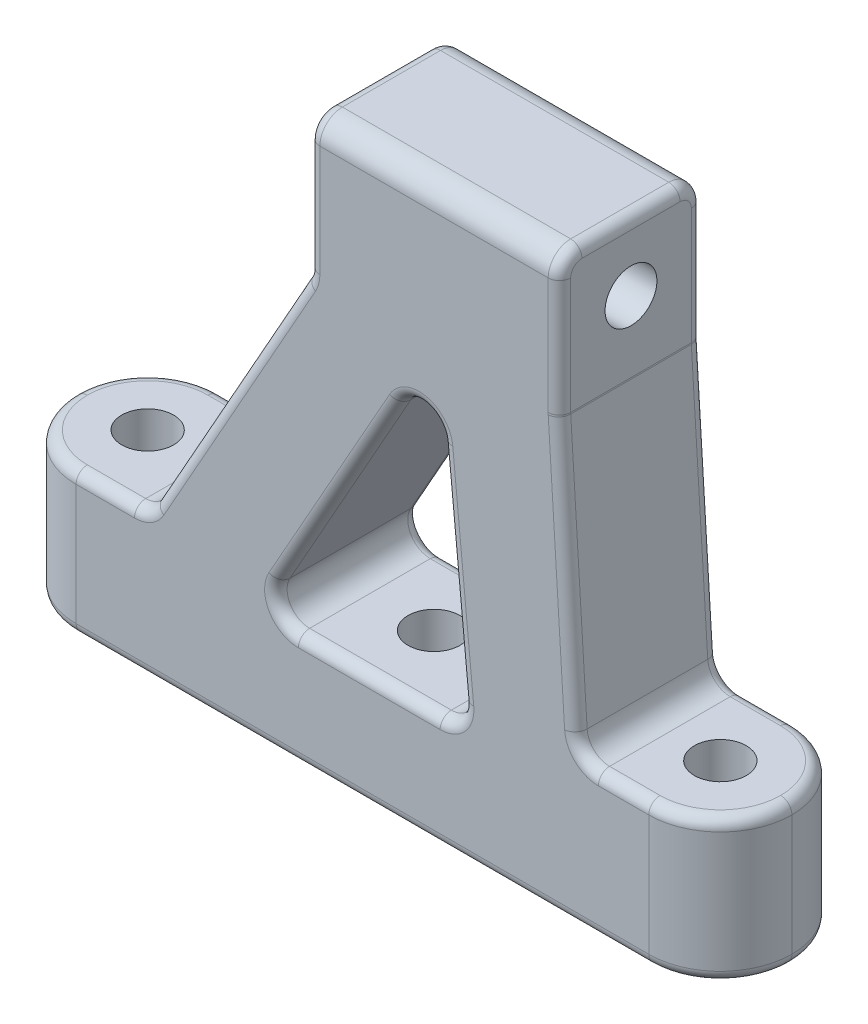
from build123d import *

# Parameters (mm, degrees)
SKETCH1_W           = 6.35
SKETCH1_H           = 12.7
SKETCH1_W_2         = 22.2504
SKETCH1_H_2         = 12.3952
BOSS_EXTRUDE1_DEPTH = 12.7
CUT_EXTRUDE1_REACH  = 52.969
SKETCH2_R           = 2.3
CUT_EXTRUDE2_REACH  = 65.601
SKETCH3_R           = 2.3
FILLET1_R           = 6.35
FILLET2_R           = 2
FILLET3_R           = 1


# Some blends are built 0.0001 mm under size
with BuildPart() as part:
    # Sketch1 → Boss-Extrude1 (new body)
    # profile 1 of 3: a face of its own
    with BuildSketch(Plane.XY):
        Polygon((-31.75, 0), (25.4, 0), (25.4, 12.7), (19.05, 12.7), (17.4752, 38.1), (-4.7752, 38.1), (-19.05, 12.7), (-31.75, 12.7), align=None)
        Polygon((9.096375634, 10), (-9.096375634, 10), (6.401231747, 37.575813845), align=None, mode=Mode.SUBTRACT)
    # profile 2 of 3: a face of its own
    with BuildSketch(Plane.XY):
        with Locations((28.575, 6.35)):
            Rectangle(SKETCH1_W, SKETCH1_H)
    # profile 3 of 3: a face of its own
    with BuildSketch(Plane.XY):
        with Locations((6.35, 44.2976)):
            Rectangle(SKETCH1_W_2, SKETCH1_H_2)
    extrude(amount=BOSS_EXTRUDE1_DEPTH)

    # Sketch2 → Cut-Extrude1 (cut, up to next)
    with BuildSketch(Plane(origin=(0, 12.7, 0), x_dir=(1, 0, 0), z_dir=(0, 1, 0)), mode=Mode.PRIVATE) as cut_extrude1_sk1:
        with Locations(Location((-25.4, -6.35, 0), (0, 0, 270))):
            Circle(SKETCH2_R)
    cut_extrude1_tool1 = extrude(cut_extrude1_sk1.sketch, amount=-CUT_EXTRUDE1_REACH, mode=Mode.PRIVATE) & part.part
    # Sketch2 → Cut-Extrude1 (cut, up to next)
    with BuildSketch(Plane(origin=(0, 12.7, 0), x_dir=(1, 0, 0), z_dir=(0, 1, 0)), mode=Mode.PRIVATE) as cut_extrude1_sk2:
        with Locations(Location((25.4, -6.35, 0), (0, 0, 270))):
            Circle(SKETCH2_R)
    cut_extrude1_tool2 = extrude(cut_extrude1_sk2.sketch, amount=-CUT_EXTRUDE1_REACH, mode=Mode.PRIVATE) & part.part
    # Sketch2 → Cut-Extrude1 (cut, up to next)
    with BuildSketch(Plane(origin=(0, 12.7, 0), x_dir=(1, 0, 0), z_dir=(0, 1, 0)), mode=Mode.PRIVATE) as cut_extrude1_sk3:
        with Locations(Location((0, -6.35, 0), (0, 0, 90))):
            Circle(SKETCH2_R)
    cut_extrude1_tool3 = extrude(cut_extrude1_sk3.sketch, amount=-CUT_EXTRUDE1_REACH, mode=Mode.PRIVATE) & part.part
    add(cut_extrude1_tool1.solids().sort_by_distance((-25.4, 12.7, 6.35))[0], mode=Mode.SUBTRACT)
    add(cut_extrude1_tool2.solids().sort_by_distance((25.4, 12.7, 6.35))[0], mode=Mode.SUBTRACT)
    add(cut_extrude1_tool3.solids().sort_by_distance((0, 12.7, 6.35))[0], mode=Mode.SUBTRACT)

    # Sketch3 → Cut-Extrude2 (cut, up to next)
    with BuildSketch(Plane.ZY.offset(4.7752), mode=Mode.PRIVATE) as cut_extrude2_sk1:
        with Locations((6.35, 44.45)):
            Circle(SKETCH3_R)
    cut_extrude2_tool1 = extrude(cut_extrude2_sk1.sketch, amount=-CUT_EXTRUDE2_REACH, mode=Mode.PRIVATE) & part.part
    add(cut_extrude2_tool1.solids().sort_by_distance((-4.7752, 44.45, 6.35))[0], mode=Mode.SUBTRACT)

    # Fillet1
    fillet1_edges = [part.edges().sort_by_distance(p)[0] for p in [
        (31.75, 6.35, 0),
        (31.75, 6.35, 12.7),
        (-31.75, 6.35, 0),
        (-31.75, 6.35, 12.7),
    ]]
    fillet(fillet1_edges, radius=FILLET1_R - 0.0001)  # a hair under: the kernel refuses the full size

    # Fillet2
    fillet2_edges = [part.edges().sort_by_distance(p)[0] for p in [
        (6.35, 50.4952, 0),
        (6.401231747, 37.575813845, 6.35),
        (-9.096375634, 10, 6.35),
        (9.096375634, 10, 6.35),
        (-19.05, 12.7, 6.35),
        (-4.7752, 38.1, 6.35),
        (17.4752, 38.1, 6.35),
        (19.05, 12.7, 6.35),
        (6.35, 50.4952, 12.7),
    ]]
    fillet(fillet2_edges, radius=FILLET2_R)

    # Fillet3
    # the kernel refuses this fillet: 1 mm, written as the material it adds along each edge
    with BuildSketch(Plane(origin=(17.4752, 38.1, 0), x_dir=(0, 1, 0), z_dir=(0, 0, 1))) as fillet3_piece_1:
        with BuildLine():
            CenterArc((FILLET3_R * 0.0309702661211, -FILLET3_R), FILLET3_R, 90, 3.54779707)
            Line((-FILLET3_R * 0.0309109123319, -FILLET3_R * 0.00191647656458), (0, 0))
            Line((0, 0), (FILLET3_R * 0.0309702661211, 0))
        make_face()
    extrude(amount=12.7)
    # the kernel refuses this fillet: 1 mm, written as the material it takes off along each edge
    with BuildSketch(Plane(origin=(-20.220204873, 12.7, 0), x_dir=(0, -1, 0), z_dir=(-1, 0, 0)), Plane(origin=(-20.220204873, 12.7, 12.7), x_dir=(0, 0, -1), z_dir=(-1, 0, 0))) as fillet3_2_piece_1:
        with BuildLine():
            CenterArc((FILLET3_R, FILLET3_R), FILLET3_R, 180, 90)
            Line((0, FILLET3_R), (0, 0))
            Line((0, 0), (FILLET3_R, 0))
        make_face()
    extrude(amount=5.179895127, mode=Mode.SUBTRACT)
    with BuildSketch(Plane(origin=(-20.220204873, 14.7, 0), x_dir=(0, -1, 0), z_dir=(-1, 0, 0))) as fillet3_2_piece_2:
        with BuildLine():
            CenterArc((2 + FILLET3_R, FILLET3_R), FILLET3_R, 180, 90)
            Line((2, FILLET3_R), (2, 0))
            Line((2, 0), (2 + FILLET3_R, 0))
        make_face()
    revolve(axis=Axis((-20.220204873, 14.7, 0), (0, 0, 1)), revolution_arc=60.664013302, mode=Mode.SUBTRACT)
    with BuildSketch(Plane(origin=(-5.031676548, 37.643636036, 0), x_dir=(0.8717617259923001, -0.48993009000767246, 0), z_dir=(-0.48993009000767246, -0.8717617259923001, 0)), Plane(origin=(-5.031676548, 37.643636036, 12.7), x_dir=(0, 0, -1), z_dir=(-0.48993009000767246, -0.8717617259923001, 0))) as fillet3_2_piece_3:
        with BuildLine():
            CenterArc((FILLET3_R, FILLET3_R), FILLET3_R, 180, 90)
            Line((0, FILLET3_R), (0, 0))
            Line((0, 0), (FILLET3_R, 0))
        make_face()
    extrude(amount=27.4427008, mode=Mode.SUBTRACT)
    with BuildSketch(Plane(origin=(-25.4001, 0, 0), x_dir=(0, 1, 0), z_dir=(1, 0, 0))) as fillet3_2_piece_4:
        with BuildLine():
            CenterArc((FILLET3_R, FILLET3_R), FILLET3_R, 180, 90)
            Line((0, FILLET3_R), (0, 0))
            Line((0, 0), (FILLET3_R, 0))
        make_face()
    extrude(amount=50.8002, mode=Mode.SUBTRACT)
    with BuildSketch(Plane(origin=(-6.7752, 38.623496216, 0), x_dir=(0.8717617259923004, -0.4899300900076718, 0), z_dir=(-0.4899300900076718, -0.8717617259923004, 0))) as fillet3_2_piece_5:
        with BuildLine():
            CenterArc((2 + FILLET3_R, FILLET3_R), FILLET3_R, 180, 90)
            Line((2, FILLET3_R), (2, 0))
            Line((2, 0), (2 + FILLET3_R, 0))
        make_face()
    revolve(axis=Axis((-6.7752, 38.623496216, 0), (0, 0, 1)), revolution_arc=29.335986698, mode=Mode.SUBTRACT)
    with BuildSketch(Plane(origin=(-4.7752, 48.4952, 0), x_dir=(1, 0, 0), z_dir=(0, -1, 0)), Plane(origin=(-4.7752, 48.4952, 12.7), x_dir=(0, 0, -1), z_dir=(0, -1, 0))) as fillet3_2_piece_6:
        with BuildLine():
            CenterArc((FILLET3_R, FILLET3_R), FILLET3_R, 180, 90)
            Line((0, FILLET3_R), (0, 0))
            Line((0, 0), (FILLET3_R, 0))
        make_face()
    extrude(amount=9.871703784, mode=Mode.SUBTRACT)
    with BuildSketch(Plane(origin=(6.891374478, 10, 0), x_dir=(0, -1, 0), z_dir=(-1, 0, 0)), Plane(origin=(6.891374478, 10, 12.7), x_dir=(0, 0, -1), z_dir=(-1, 0, 0))) as fillet3_2_piece_7:
        with BuildLine():
            CenterArc((FILLET3_R, FILLET3_R), FILLET3_R, 180, 90)
            Line((0, FILLET3_R), (0, 0))
            Line((0, 0), (FILLET3_R, 0))
        make_face()
    extrude(amount=12.569545239, mode=Mode.SUBTRACT)
    with BuildSketch(Plane(origin=(6.891374478, 12, 0), x_dir=(0, -1, 0), z_dir=(-1, 0, 0))) as fillet3_2_piece_8:
        with BuildLine():
            CenterArc((2 + FILLET3_R, FILLET3_R), FILLET3_R, 180, 90)
            Line((2, FILLET3_R), (2, 0))
            Line((2, 0), (2 + FILLET3_R, 0))
        make_face()
    revolve(axis=Axis((6.891374478, 12, 0), (0, 0, 1)), revolution_arc=95.582119196, mode=Mode.SUBTRACT)
    with BuildSketch(Plane(origin=(-5.678170761, 12, 0), x_dir=(0, -1, 0), z_dir=(1, 0, 0))) as fillet3_2_piece_9:
        with BuildLine():
            CenterArc((2 + FILLET3_R, -FILLET3_R), FILLET3_R, 90, 90)
            Line((2, -FILLET3_R), (2, 0))
            Line((2, 0), (2 + FILLET3_R, 0))
        make_face()
    revolve(axis=Axis((-5.678170761, 12, 0), (0, 0, -1)), revolution_arc=119.335986698, mode=Mode.SUBTRACT)
    with BuildSketch(Plane(origin=(7.01978949, 31.24693721, 0), x_dir=(0.9952578050812044, 0.0972723055393634, 0), z_dir=(0.0972723055393634, -0.9952578050812044, 0)), Plane(origin=(7.01978949, 31.24693721, 12.7), x_dir=(0, 0, -1), z_dir=(0.0972723055393634, -0.9952578050812044, 0))) as fillet3_2_piece_10:
        with BuildLine():
            CenterArc((FILLET3_R, FILLET3_R), FILLET3_R, 180, 90)
            Line((0, FILLET3_R), (0, 0))
            Line((0, 0), (FILLET3_R, 0))
        make_face()
    extrude(amount=19.143173258, mode=Mode.SUBTRACT)
    with BuildSketch(Plane(origin=(-7.421694213, 12.97986018, 0), x_dir=(-0.8717617259923001, 0.48993009000767257, 0), z_dir=(0.48993009000767257, 0.8717617259923001, 0)), Plane(origin=(-7.421694213, 12.97986018, 12.7), x_dir=(0, 0, -1), z_dir=(0.48993009000767257, 0.8717617259923001, 0))) as fillet3_2_piece_11:
        with BuildLine():
            CenterArc((FILLET3_R, FILLET3_R), FILLET3_R, 180, 90)
            Line((0, FILLET3_R), (0, 0))
            Line((0, 0), (FILLET3_R, 0))
        make_face()
    extrude(amount=21.855045973, mode=Mode.SUBTRACT)
    with BuildSketch(Plane(origin=(5.02927388, 31.052392599, 0), x_dir=(-0.8717617259923004, 0.4899300900076719, 0), z_dir=(-0.4899300900076719, -0.8717617259923004, 0))) as fillet3_2_piece_12:
        with BuildLine():
            CenterArc((2 + FILLET3_R, -FILLET3_R), FILLET3_R, 90, 90)
            Line((2, -FILLET3_R), (2, 0))
            Line((2, 0), (2 + FILLET3_R, 0))
        make_face()
    revolve(axis=Axis((5.02927388, 31.052392599, 0), (0, 0, -1)), revolution_arc=145.081894106, mode=Mode.SUBTRACT)
    with BuildSketch(Plane(origin=(-25.4001, 12.7, 6.3499), x_dir=(-1, 0, 0), z_dir=(0, 0, 1))) as fillet3_2_piece_13:
        with BuildLine():
            CenterArc((6.3499 - FILLET3_R, FILLET3_R), FILLET3_R, 270, 90)
            Line((6.3499, FILLET3_R), (6.3499, 0))
            Line((6.3499, 0), (6.3499 - FILLET3_R, 0))
        make_face()
    revolve(axis=Axis((-25.4001, 12.7, 6.3499), (0, -1, 0)), revolution_arc=90, mode=Mode.SUBTRACT)
    with BuildSketch(Plane(origin=(-31.75, 12.7, 6.3499), x_dir=(1, 0, 0), z_dir=(0, 0, 1)), Plane(origin=(31.75, 0, 6.3499), x_dir=(-1, 0, 0), z_dir=(0, 0, 1))) as fillet3_2_piece_14:
        with BuildLine():
            CenterArc((FILLET3_R, -FILLET3_R), FILLET3_R, 90, 90)
            Line((0, -FILLET3_R), (0, 0))
            Line((0, 0), (FILLET3_R, 0))
        make_face()
    extrude(amount=0.0002, mode=Mode.SUBTRACT)
    with BuildSketch(Plane(origin=(-25.4001, 12.7, 6.3501), x_dir=(-1, 0, 0), z_dir=(0, 0, -1))) as fillet3_2_piece_15:
        with BuildLine():
            CenterArc((6.3499 - FILLET3_R, -FILLET3_R), FILLET3_R, 0, 90)
            Line((6.3499, -FILLET3_R), (6.3499, 0))
            Line((6.3499, 0), (6.3499 - FILLET3_R, 0))
        make_face()
    revolve(axis=Axis((-25.4001, 12.7, 6.3501), (0, 1, 0)), revolution_arc=90, mode=Mode.SUBTRACT)
    with BuildSketch(Plane(origin=(-20.220204873, 14.7, 12.7), x_dir=(0, -1, 0), z_dir=(-1, 0, 0))) as fillet3_2_piece_16:
        with BuildLine():
            CenterArc((2 + FILLET3_R, -FILLET3_R), FILLET3_R, 90, 90)
            Line((2 + FILLET3_R, 0), (2, 0))
            Line((2, 0), (2, -FILLET3_R))
        make_face()
    revolve(axis=Axis((-20.220204873, 14.7, 12.7), (0, 0, 1)), revolution_arc=60.664013302, mode=Mode.SUBTRACT)
    with BuildSketch(Plane(origin=(-25.4001, 0, 6.3499), x_dir=(-1, 0, 0), z_dir=(0, 0, 1))) as fillet3_2_piece_17:
        with BuildLine():
            CenterArc((6.3499 - FILLET3_R, -FILLET3_R), FILLET3_R, 0, 90)
            Line((6.3499 - FILLET3_R, 0), (6.3499, 0))
            Line((6.3499, 0), (6.3499, -FILLET3_R))
        make_face()
    revolve(axis=Axis((-25.4001, 0, 6.3499), (0, -1, 0)), revolution_arc=90, mode=Mode.SUBTRACT)
    with BuildSketch(Plane(origin=(-31.75, 0, 6.3499), x_dir=(1, 0, 0), z_dir=(0, 0, 1))) as fillet3_2_piece_18:
        with BuildLine():
            CenterArc((FILLET3_R, FILLET3_R), FILLET3_R, 180, 90)
            Line((0, FILLET3_R), (0, 0))
            Line((0, 0), (FILLET3_R, 0))
        make_face()
    extrude(amount=0.0002, mode=Mode.SUBTRACT)
    with BuildSketch(Plane(origin=(-25.4001, 0, 6.3501), x_dir=(-1, 0, 0), z_dir=(0, 0, -1))) as fillet3_2_piece_19:
        with BuildLine():
            CenterArc((6.3499 - FILLET3_R, FILLET3_R), FILLET3_R, 270, 90)
            Line((6.3499, FILLET3_R), (6.3499, 0))
            Line((6.3499, 0), (6.3499 - FILLET3_R, 0))
        make_face()
    revolve(axis=Axis((-25.4001, 0, 6.3501), (0, 1, 0)), revolution_arc=90, mode=Mode.SUBTRACT)
    with BuildSketch(Plane(origin=(25.4001, 0, 12.7), x_dir=(0, 0, -1), z_dir=(-1, 0, 0))) as fillet3_2_piece_20:
        with BuildLine():
            CenterArc((FILLET3_R, -FILLET3_R), FILLET3_R, 90, 90)
            Line((0, -FILLET3_R), (0, 0))
            Line((0, 0), (FILLET3_R, 0))
        make_face()
    extrude(amount=50.8002, mode=Mode.SUBTRACT)
    with BuildSketch(Plane(origin=(25.4001, 0, 6.3499), x_dir=(0, 0, -1), z_dir=(-1, 0, 0))) as fillet3_2_piece_21:
        with BuildLine():
            CenterArc((6.3499 - FILLET3_R, -FILLET3_R), FILLET3_R, 0, 90)
            Line((6.3499, -FILLET3_R), (6.3499, 0))
            Line((6.3499, 0), (6.3499 - FILLET3_R, 0))
        make_face()
    revolve(axis=Axis((25.4001, 0, 6.3499), (0, -1, 0)), revolution_arc=90, mode=Mode.SUBTRACT)
    with BuildSketch(Plane(origin=(25.4001, 0, 6.3501), x_dir=(0, 0, 1), z_dir=(-1, 0, 0))) as fillet3_2_piece_22:
        with BuildLine():
            CenterArc((6.3499 - FILLET3_R, FILLET3_R), FILLET3_R, 270, 90)
            Line((6.3499, FILLET3_R), (6.3499, 0))
            Line((6.3499, 0), (6.3499 - FILLET3_R, 0))
        make_face()
    revolve(axis=Axis((25.4001, 0, 6.3501), (0, 1, 0)), revolution_arc=90, mode=Mode.SUBTRACT)
    with BuildSketch(Plane(origin=(-6.7752, 38.623496216, 12.7), x_dir=(0.8717617259923004, -0.4899300900076718, 0), z_dir=(-0.4899300900076718, -0.8717617259923004, 0))) as fillet3_2_piece_23:
        with BuildLine():
            CenterArc((2 + FILLET3_R, -FILLET3_R), FILLET3_R, 90, 90)
            Line((2 + FILLET3_R, 0), (2, 0))
            Line((2, 0), (2, -FILLET3_R))
        make_face()
    revolve(axis=Axis((-6.7752, 38.623496216, 12.7), (0, 0, 1)), revolution_arc=29.335986698, mode=Mode.SUBTRACT)
    with BuildSketch(Plane(origin=(-4.7752, 50.4952, 2), x_dir=(0, -1, 0), z_dir=(0, 0, 1))) as fillet3_2_piece_24:
        with BuildLine():
            CenterArc((FILLET3_R, FILLET3_R), FILLET3_R, 180, 90)
            Line((0, FILLET3_R), (0, 0))
            Line((0, 0), (FILLET3_R, 0))
        make_face()
    extrude(amount=8.7, mode=Mode.SUBTRACT)
    with BuildSketch(Plane(origin=(-4.7752, 48.4952, 2), x_dir=(0, 0, -1), z_dir=(0, -1, 0))) as fillet3_2_piece_25:
        with BuildLine():
            CenterArc((2 - FILLET3_R, FILLET3_R), FILLET3_R, 270, 90)
            Line((2, FILLET3_R), (2, 0))
            Line((2, 0), (2 - FILLET3_R, 0))
        make_face()
    revolve(axis=Axis((-4.7752, 48.4952, 2), (1, 0, 0)), revolution_arc=90, mode=Mode.SUBTRACT)
    with BuildSketch(Plane(origin=(-4.7752, 48.4952, 10.7), x_dir=(0, 0, 1), z_dir=(0, -1, 0))) as fillet3_2_piece_26:
        with BuildLine():
            CenterArc((2 - FILLET3_R, -FILLET3_R), FILLET3_R, 0, 90)
            Line((2, -FILLET3_R), (2, 0))
            Line((2, 0), (2 - FILLET3_R, 0))
        make_face()
    revolve(axis=Axis((-4.7752, 48.4952, 10.7), (-1, 0, 0)), revolution_arc=90, mode=Mode.SUBTRACT)
    with BuildSketch(Plane(origin=(6.891374478, 12, 12.7), x_dir=(0, -1, 0), z_dir=(-1, 0, 0))) as fillet3_2_piece_27:
        with BuildLine():
            CenterArc((2 + FILLET3_R, -FILLET3_R), FILLET3_R, 90, 90)
            Line((2 + FILLET3_R, 0), (2, 0))
            Line((2, 0), (2, -FILLET3_R))
        make_face()
    revolve(axis=Axis((6.891374478, 12, 12.7), (0, 0, 1)), revolution_arc=95.582119196, mode=Mode.SUBTRACT)
    with BuildSketch(Plane(origin=(-5.678170761, 12, 12.7), x_dir=(0, -1, 0), z_dir=(1, 0, 0))) as fillet3_2_piece_28:
        with BuildLine():
            CenterArc((2 + FILLET3_R, FILLET3_R), FILLET3_R, 180, 90)
            Line((2 + FILLET3_R, 0), (2, 0))
            Line((2, 0), (2, FILLET3_R))
        make_face()
    revolve(axis=Axis((-5.678170761, 12, 12.7), (0, 0, -1)), revolution_arc=119.335986698, mode=Mode.SUBTRACT)
    with BuildSketch(Plane(origin=(5.02927388, 31.052392599, 12.7), x_dir=(-0.8717617259923004, 0.4899300900076719, 0), z_dir=(-0.4899300900076719, -0.8717617259923004, 0))) as fillet3_2_piece_29:
        with BuildLine():
            CenterArc((2 + FILLET3_R, FILLET3_R), FILLET3_R, 180, 90)
            Line((2 + FILLET3_R, 0), (2, 0))
            Line((2, 0), (2, FILLET3_R))
        make_face()
    revolve(axis=Axis((5.02927388, 31.052392599, 12.7), (0, 0, -1)), revolution_arc=145.081894106, mode=Mode.SUBTRACT)
    # the kernel refuses this fillet: 1 mm, written as the material it takes off along each edge
    with BuildSketch(Plane(origin=(20.929840313, 12.7, 0), x_dir=(0, -1, 0), z_dir=(1, 0, 0))) as fillet3_3_piece_1:
        with BuildLine():
            CenterArc((FILLET3_R, -FILLET3_R), FILLET3_R, 90, 90)
            Line((0, -FILLET3_R), (0, 0))
            Line((0, 0), (FILLET3_R, 0))
        make_face()
    extrude(amount=4.470259687, mode=Mode.SUBTRACT)
    with BuildSketch(Plane(origin=(20.929840313, 14.7, 0), x_dir=(0, -1, 0), z_dir=(1, 0, 0))) as fillet3_3_piece_2:
        with BuildLine():
            CenterArc((2 + FILLET3_R, -FILLET3_R), FILLET3_R, 90, 90)
            Line((2, -FILLET3_R), (2, 0))
            Line((2, 0), (2 + FILLET3_R, 0))
        make_face()
    revolve(axis=Axis((20.929840313, 14.7, 0), (0, 0, -1)), revolution_arc=86.45220293, mode=Mode.SUBTRACT)
    with BuildSketch(Plane(origin=(17.4752, 38.130970266, 0), x_dir=(-1, 0, 0), z_dir=(0, 1, 0)), Plane(origin=(17.4752, 38.130970266, 12.7), x_dir=(0, 0, -1), z_dir=(0, 1, 0))) as fillet3_3_piece_3:
        with BuildLine():
            CenterArc((FILLET3_R, FILLET3_R), FILLET3_R, 180, 90)
            Line((0, FILLET3_R), (0, 0))
            Line((0, 0), (FILLET3_R, 0))
        make_face()
    extrude(amount=10.364229734, mode=Mode.SUBTRACT)
    with BuildSketch(Plane(origin=(18.933673266, 14.576237643, 0), x_dir=(-0.998083523435423, -0.06188117845299633, 0), z_dir=(-0.06188117845299633, 0.998083523435423, 0)), Plane(origin=(18.933673266, 14.576237643, 12.7), x_dir=(0, 0, -1), z_dir=(-0.06188117845299633, 0.998083523435423, 0))) as fillet3_3_piece_4:
        with BuildLine():
            CenterArc((FILLET3_R, FILLET3_R), FILLET3_R, 180, 90)
            Line((0, FILLET3_R), (0, 0))
            Line((0, 0), (FILLET3_R, 0))
        make_face()
    extrude(amount=23.537961396, mode=Mode.SUBTRACT)
    with BuildSketch(Plane(origin=(25.4001, 12.7, 6.3499), x_dir=(0, 0, -1), z_dir=(-1, 0, 0))) as fillet3_3_piece_5:
        with BuildLine():
            CenterArc((6.3499 - FILLET3_R, FILLET3_R), FILLET3_R, 270, 90)
            Line((6.3499, FILLET3_R), (6.3499, 0))
            Line((6.3499, 0), (6.3499 - FILLET3_R, 0))
        make_face()
    revolve(axis=Axis((25.4001, 12.7, 6.3499), (0, -1, 0)), revolution_arc=90, mode=Mode.SUBTRACT)
    with BuildSketch(Plane(origin=(25.4001, 12.7, 12.7), x_dir=(0, 0, -1), z_dir=(-1, 0, 0))) as fillet3_3_piece_6:
        with BuildLine():
            CenterArc((FILLET3_R, FILLET3_R), FILLET3_R, 180, 90)
            Line((0, FILLET3_R), (0, 0))
            Line((0, 0), (FILLET3_R, 0))
        make_face()
    extrude(amount=4.470259687, mode=Mode.SUBTRACT)
    with BuildSketch(Plane(origin=(31.75, 12.7, 6.3499), x_dir=(-1, 0, 0), z_dir=(0, 0, 1))) as fillet3_3_piece_7:
        with BuildLine():
            CenterArc((FILLET3_R, FILLET3_R), FILLET3_R, 180, 90)
            Line((0, FILLET3_R), (0, 0))
            Line((0, 0), (FILLET3_R, 0))
        make_face()
    extrude(amount=0.0002, mode=Mode.SUBTRACT)
    with BuildSketch(Plane(origin=(25.4001, 12.7, 6.3501), x_dir=(0, 0, 1), z_dir=(-1, 0, 0))) as fillet3_3_piece_8:
        with BuildLine():
            CenterArc((6.3499 - FILLET3_R, -FILLET3_R), FILLET3_R, 0, 90)
            Line((6.3499, -FILLET3_R), (6.3499, 0))
            Line((6.3499, 0), (6.3499 - FILLET3_R, 0))
        make_face()
    revolve(axis=Axis((25.4001, 12.7, 6.3501), (0, 1, 0)), revolution_arc=90, mode=Mode.SUBTRACT)
    with BuildSketch(Plane(origin=(17.4752, 48.4952, 2), x_dir=(0, 0, -1), z_dir=(0, -1, 0))) as fillet3_3_piece_9:
        with BuildLine():
            CenterArc((2 - FILLET3_R, -FILLET3_R), FILLET3_R, 0, 90)
            Line((2 - FILLET3_R, 0), (2, 0))
            Line((2, 0), (2, -FILLET3_R))
        make_face()
    revolve(axis=Axis((17.4752, 48.4952, 2), (1, 0, 0)), revolution_arc=90, mode=Mode.SUBTRACT)
    with BuildSketch(Plane(origin=(20.929840313, 14.7, 12.7), x_dir=(0, -1, 0), z_dir=(1, 0, 0))) as fillet3_3_piece_10:
        with BuildLine():
            CenterArc((2 + FILLET3_R, FILLET3_R), FILLET3_R, 180, 90)
            Line((2 + FILLET3_R, 0), (2, 0))
            Line((2, 0), (2, FILLET3_R))
        make_face()
    revolve(axis=Axis((20.929840313, 14.7, 12.7), (0, 0, -1)), revolution_arc=86.45220293, mode=Mode.SUBTRACT)
    with BuildSketch(Plane(origin=(17.4752, 50.4952, 2), x_dir=(0, -1, 0), z_dir=(0, 0, 1))) as fillet3_3_piece_11:
        with BuildLine():
            CenterArc((FILLET3_R, -FILLET3_R), FILLET3_R, 90, 90)
            Line((0, -FILLET3_R), (0, 0))
            Line((0, 0), (FILLET3_R, 0))
        make_face()
    extrude(amount=8.7, mode=Mode.SUBTRACT)
    with BuildSketch(Plane(origin=(17.4752, 48.4952, 10.7), x_dir=(0, 0, 1), z_dir=(0, -1, 0))) as fillet3_3_piece_12:
        with BuildLine():
            CenterArc((2 - FILLET3_R, FILLET3_R), FILLET3_R, 270, 90)
            Line((2, FILLET3_R), (2, 0))
            Line((2, 0), (2 - FILLET3_R, 0))
        make_face()
    revolve(axis=Axis((17.4752, 48.4952, 10.7), (-1, 0, 0)), revolution_arc=90, mode=Mode.SUBTRACT)
    with BuildSketch(Plane(origin=(18.4752, 38.130970266, 12.7), x_dir=(-1, 0, 0), z_dir=(0, 1, 0))) as fillet3_3_piece_13:
        with BuildLine():
            CenterArc((1 + FILLET3_R, -FILLET3_R), FILLET3_R, 90, 90)
            Line((1 + FILLET3_R, 0), (1, 0))
            Line((1, 0), (1, -FILLET3_R))
        make_face()
    revolve(axis=Axis((18.4752, 38.130970266, 12.7), (0, 0, 1)), revolution_arc=3.54779707, mode=Mode.SUBTRACT)
    with BuildSketch(Plane(origin=(18.4752, 38.130970266, 0), x_dir=(-1, 0, 0), z_dir=(0, 1, 0))) as fillet3_3_piece_14:
        with BuildLine():
            CenterArc((1 + FILLET3_R, FILLET3_R), FILLET3_R, 180, 90)
            Line((1, FILLET3_R), (1, 0))
            Line((1, 0), (1 + FILLET3_R, 0))
        make_face()
    revolve(axis=Axis((18.4752, 38.130970266, 0), (0, 0, 1)), revolution_arc=3.54779707, mode=Mode.SUBTRACT)


solid = part.part
